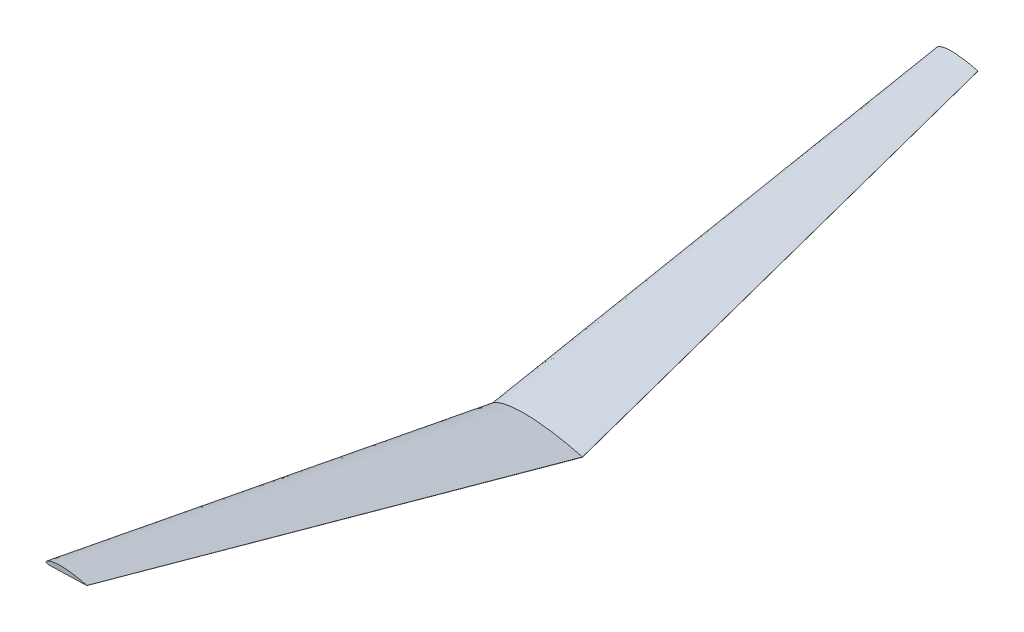
from build123d import *


with BuildPart() as part:
    # Sketch2 for Loft1 → Loft1 section 0
    with BuildSketch(Plane.XY.offset(490.8136)):
        with BuildLine():
            # circular arc as an exact rational Bezier (weights 1, cos(half-angle), 1)
            Bezier((44.999999916, 95.46299), (45.218011138, 95.40449), (44.999999916, 95.34599), weights=[1, 0.259166522, 1])
            add(Edge.make_bspline(
                [(44.999999916, 95.46299), (44.250773182, 95.666946435), (42.755935382, 96.073875039), (39.761341997, 96.81377162), (36.016499759, 97.63126735), (31.512166398, 98.437122576), (27.011324898, 99.097672883), (22.507975569, 99.568843059), (18.005018622, 99.862707343), (14.245896075, 99.865679337), (11.244449368, 99.658029272), (8.990322945, 99.384516753), (6.731324744, 98.981165146), (4.859372551, 98.496077627), (3.359278701, 98.006159439), (2.228173261, 97.543654026), (1.263052468, 97.043466637), (0.425326829, 96.445154313), (-0.303918779, 95.482878768), (0.483205893, 94.746950219), (1.286388798, 94.458070896), (2.242924401, 94.263090073), (3.372590577, 94.163956363), (4.874376312, 94.093797485), (6.750469603, 94.099052433), (9.00097655, 94.162029134), (11.249895553, 94.281941002), (14.24990731, 94.422249346), (17.999281608, 94.602302748), (22.500129741, 94.771374297), (26.999531996, 94.95911384), (31.499364778, 95.11901979), (35.999558053, 95.236640649), (39.749887316, 95.296360142), (42.749931523, 95.335688514), (44.249990618, 95.342556233), (44.999999916, 95.34599)],
                knots=[0, 0, 0, 0, 0.025304886, 0.050487653, 0.100520433, 0.150190716, 0.199586607, 0.248740009, 0.297715539, 0.346600594, 0.371102737, 0.395726297, 0.420570145, 0.445825119, 0.458702216, 0.471919982, 0.485786003, 0.493461051, 0.506863029, 0.51614777, 0.522766003, 0.535269014, 0.547551134, 0.559786371, 0.584228898, 0.60868081, 0.633151284, 0.657621757, 0.706558114, 0.75548187, 0.804405627, 0.853320224, 0.902221408, 0.951113136, 0.975557228, 1, 1, 1, 1], degree=3))
        make_face()
    # Sketch1 for Loft1 → Loft1 section 1
    with BuildSketch(Plane.XY):
        with BuildLine():
            Bezier((100.04096197, 0.130053251), (100.459155973, 0), (100.04096197, -0.130053251), weights=[1, 0.29695923, 1])
            add(Edge.make_bspline(
                [(100.04096197, 0.130053251), (98.375331673, 0.583475429), (95.05210919, 1.48813163), (88.394731334, 3.133019761), (80.069450875, 4.95042108), (70.055721025, 6.741944018), (60.049754043, 8.210434867), (50.038211826, 9.257908596), (40.027541925, 9.911207834), (31.670514448, 9.91781497), (24.997900748, 9.456181362), (19.986679057, 8.848126795), (14.964626755, 7.951422733), (10.803029011, 6.873008906), (7.468121632, 5.783855864), (4.953524376, 4.755645054), (2.807932982, 3.643662215), (0.945557892, 2.313534648), (-0.675651712, 0.174268617), (1.074230721, -1.461798052), (2.859812736, -2.104015061), (4.986318113, -2.537483265), (7.497715695, -2.757870636), (10.836384359, -2.913843118), (15.007188314, -2.902160673), (20.01036343, -2.762155121), (25.01000834, -2.495575151), (31.679431955, -2.183651112), (40.014787783, -1.783368545), (50.02076951, -1.40750009), (60.023536859, -0.990130213), (70.027261326, -0.634638099), (80.031787218, -0.373151346), (88.369266059, -0.240387), (95.038761815, -0.152954819), (98.373591929, -0.137686969), (100.04096197, -0.130053251)],
                knots=[0, 0, 0, 0, 0.025304886, 0.050487653, 0.100520433, 0.150190716, 0.199586607, 0.248740009, 0.297715539, 0.346600594, 0.371102737, 0.395726297, 0.420570145, 0.445825119, 0.458702216, 0.471919982, 0.485786003, 0.493461051, 0.506863029, 0.51614777, 0.522766003, 0.535269014, 0.547551134, 0.559786371, 0.584228898, 0.60868081, 0.633151284, 0.657621757, 0.706558114, 0.75548187, 0.804405627, 0.853320224, 0.902221408, 0.951113136, 0.975557228, 1, 1, 1, 1], degree=3))
        make_face()
    loft1 = loft()

    # Mirror1: Loft1 across plane
    add(loft1.mirror(Plane(origin=(0.307784344, 1.311245012, 0), x_dir=(1, 0, 0), z_dir=(0, 0, -1))))


solid = part.part
